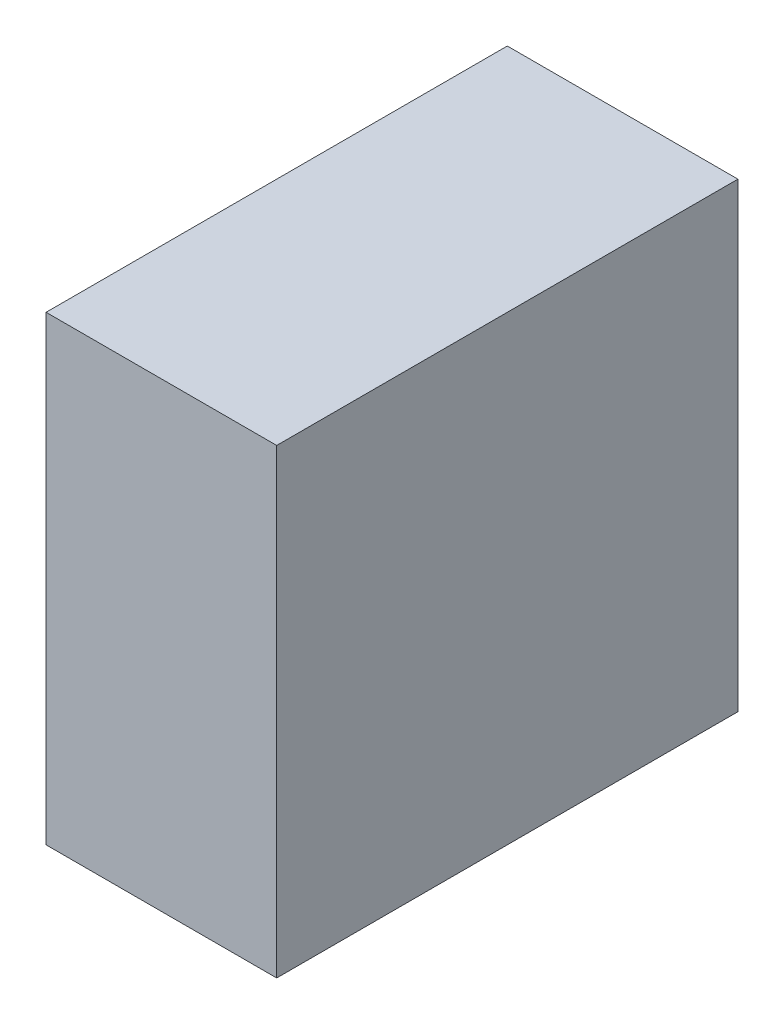
from build123d import *

# Parameters (mm, degrees)
SKETCH1_W      = 3.175
SKETCH1_H      = 3.175
EXTRUDE1_DEPTH = 0.79375


with BuildPart() as part:
    # Sketch1 → Extrude1 (new, symmetric)
    with BuildSketch(Plane(origin=(0, 0, 0), x_dir=(0, 0, -1), z_dir=(1, 0, 0))):
        Rectangle(SKETCH1_W, SKETCH1_H)
    extrude(amount=EXTRUDE1_DEPTH, both=True)


solid = part.part
